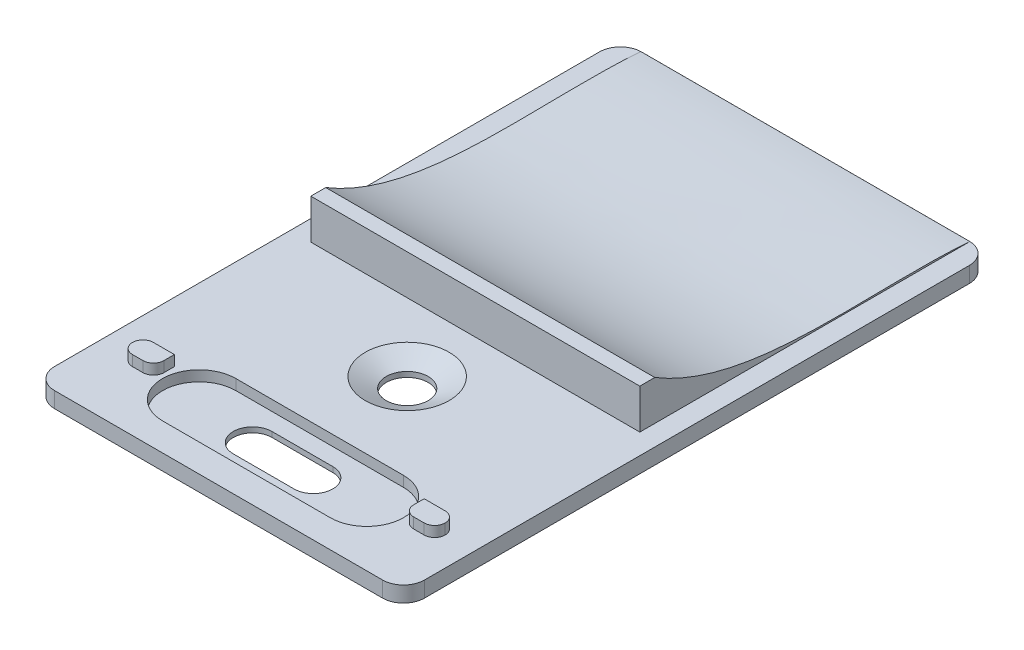
from build123d import *

# Parameters (mm, degrees)
SKETCH1_W               = 35.3
SKETCH1_H               = 26
BOSS_EXTRUDE1_DEPTH     = 1.5
SKETCH2_W               = 31.8
SKETCH2_H               = 1.5
BOSS_EXTRUDE2_DEPTH     = 3.8
CUT_EXTRUDE1_DEPTH      = 23.247752695
CUT_EXTRUDE1_DEPTH_BACK = 23.247752695
SKETCH3_R               = 2
CHAMFER1_SIZE           = 2
CHAMFER1_SIZE2          = 1
FILLET1_R               = 2
BOSS_EXTRUDE3_DEPTH     = 30
FILLET2_R               = 2
SKETCH6_W               = 3
SKETCH6_H               = 2
BOSS_EXTRUDE4_DEPTH     = 1
FILLET4_R               = 1
SKETCH7_W               = 1.743977538
SKETCH7_H               = 6.350659455
SKETCH7_W_2             = 2.282976844
SKETCH7_H_2             = 7.649157782
CUT_EXTRUDE2_DEPTH      = 37.494691395
CUT_EXTRUDE5_DEPTH      = 55.674605623
CUT_EXTRUDE5_DEPTH_BACK = 55.674605623
CUT_EXTRUDE6_DEPTH      = 47.63649323
CUT_EXTRUDE6_DEPTH_BACK = 47.63649323
CUT_EXTRUDE7_START      = -1.5
CUT_EXTRUDE7_DEPTH      = 1


with BuildPart() as part:
    # Sketch1 → Boss-Extrude1 (new body)
    with BuildSketch(Plane(origin=(0, 0, 0), x_dir=(1, 0, 0), z_dir=(0, 1, 0))):
        Rectangle(SKETCH1_W, SKETCH1_H)
    extrude(amount=BOSS_EXTRUDE1_DEPTH)

    # Sketch2 → Boss-Extrude2 (add)
    with BuildSketch(Plane(origin=(0, 1.5, 0), x_dir=(1, 0, 0), z_dir=(0, 1, 0))):
        with Locations((0, 12.25)):
            Rectangle(SKETCH2_W, SKETCH2_H)
    extrude(amount=BOSS_EXTRUDE2_DEPTH)

    # Sketch3 → Cut-Extrude1 (cut, two sides: drawn at the far end of the back side and taken through both)
    with BuildSketch(Plane(origin=(0, 1.5, 0), x_dir=(1, 0, 0), z_dir=(0, 1, 0)).offset(-CUT_EXTRUDE1_DEPTH_BACK)):
        with Locations(Location((0, 5, 0), (0, 0, 270))):
            Circle(SKETCH3_R)
    extrude(amount=CUT_EXTRUDE1_DEPTH + CUT_EXTRUDE1_DEPTH_BACK, mode=Mode.SUBTRACT)

    # Chamfer1
    chamfer1_edges = [part.edges().sort_by_distance(p)[0] for p in [
        (0, 1.5, -7),
    ]]
    chamfer1_side = [part.faces().sort_by_distance(p)[0] for p in [
        (0, 1.5, 0.754672273),
    ]]
    chamfer(chamfer1_edges, length=CHAMFER1_SIZE, length2=CHAMFER1_SIZE2, reference=chamfer1_side[0])

    # Fillet1
    fillet1_edges = [part.edges().sort_by_distance(p)[0] for p in [
        (17.65, 0.75, 13),
        (-17.65, 0.75, 13),
    ]]
    fillet(fillet1_edges, radius=FILLET1_R)

    # Sketch4 → Boss-Extrude3 (add)
    with BuildSketch(Plane(origin=(0, 0, -13), x_dir=(-1, 0, 0), z_dir=(0, 0, -1))):
        Polygon((-15.9, 5.3), (-15.9, 1.5), (-17.65, 1.5), (-17.65, 0), (17.65, 0), (17.65, 1.5), (15.9, 1.5), (15.9, 5.3), align=None)
    extrude(amount=BOSS_EXTRUDE3_DEPTH)

    # Fillet2
    fillet2_edges = [part.edges().sort_by_distance(p)[0] for p in [
        (-17.65, 0.75, -43),
        (17.65, 0.75, -43),
    ]]
    fillet(fillet2_edges, radius=FILLET2_R)

    # Sketch6 → Boss-Extrude4 (add)
    with BuildSketch(Plane(origin=(0, 1.5, 0), x_dir=(1, 0, 0), z_dir=(0, 1, 0))):
        with Locations((-13.42, -6.3)):
            Rectangle(SKETCH6_W, SKETCH6_H)
        with Locations((13.42, -6.3)):
            Rectangle(SKETCH6_W, SKETCH6_H)
    extrude(amount=BOSS_EXTRUDE4_DEPTH)

    # Fillet4
    fillet4_edges = [part.edges().sort_by_distance(p)[0] for p in [
        (-14.92, 2, 5.3),
        (14.92, 2, 5.3),
        (14.92, 2, 7.3),
        (11.92, 2, 7.3),
        (-11.92, 2, 7.3),
        (-14.92, 2, 7.3),
    ]]
    fillet(fillet4_edges, radius=FILLET4_R - 0.0001)  # a hair under: the kernel refuses the full size

    # Sketch7 → Cut-Extrude2 (cut, through all)
    with BuildSketch(Plane.XY.offset(-11.5)):
        with Locations((-16.571988769, 4.675329728)):
            Rectangle(SKETCH7_W, SKETCH7_H)
        with Locations((16.841488422, 5.324578891)):
            Rectangle(SKETCH7_W_2, SKETCH7_H_2)
    extrude(amount=-CUT_EXTRUDE2_DEPTH, mode=Mode.SUBTRACT)

    # Sketch10 → Cut-Extrude5 (cut, two sides: drawn at the far end of the back side and taken through both)
    with BuildSketch(Plane(origin=(15.7, 0, 0), x_dir=(0, 0, -1), z_dir=(1, 0, 0)).offset(-CUT_EXTRUDE5_DEPTH_BACK)):
        with BuildLine():
            Line((12.925241615, 5.3), (13.354629123, 9.309511059))
            Line((13.354629123, 9.309511059), (48.378706372, 9.920156593))
            Line((48.378706372, 9.920156593), (42.999374902, 1.5))
            add(Edge.make_bspline(
                [(12.925241615, 5.3), (21.883759375, -0.11684658), (33.318611191, 2.283464976), (42.999374902, 1.5)],
                knots=[0, 0, 0, 0, 1, 1, 1, 1], degree=3))
        make_face()
    extrude(amount=CUT_EXTRUDE5_DEPTH + CUT_EXTRUDE5_DEPTH_BACK, mode=Mode.SUBTRACT)

    # Sketch12 → Cut-Extrude6 (cut, two sides: drawn at the far end of the back side and taken through both)
    with BuildSketch(Plane(origin=(0, 1.5, 0), x_dir=(1, 0, 0), z_dir=(0, 1, 0)).offset(-CUT_EXTRUDE6_DEPTH_BACK)):
        with BuildLine():
            Line((-2.9, -5), (2.9, -5))
            ThreePointArc((2.9, -5), (4.75, -6.85), (2.9, -8.7))
            Line((2.9, -8.7), (-2.9, -8.7))
            ThreePointArc((-2.9, -8.7), (-4.75, -6.85), (-2.9, -5))
        make_face()
    extrude(amount=CUT_EXTRUDE6_DEPTH + CUT_EXTRUDE6_DEPTH_BACK, mode=Mode.SUBTRACT)

    # Sketch13 → Cut-Extrude7 (cut)
    with BuildSketch(Plane.XZ.offset(CUT_EXTRUDE7_START)):
        with BuildLine():
            Line((-8, 10.35), (8, 10.35))
            ThreePointArc((8, 10.35), (11.5, 6.85), (8, 3.35))
            Line((8, 3.35), (-8, 3.35))
            ThreePointArc((-8, 3.35), (-11.5, 6.85), (-8, 10.35))
        make_face()
    extrude(amount=CUT_EXTRUDE7_DEPTH, mode=Mode.SUBTRACT)


solid = part.part
